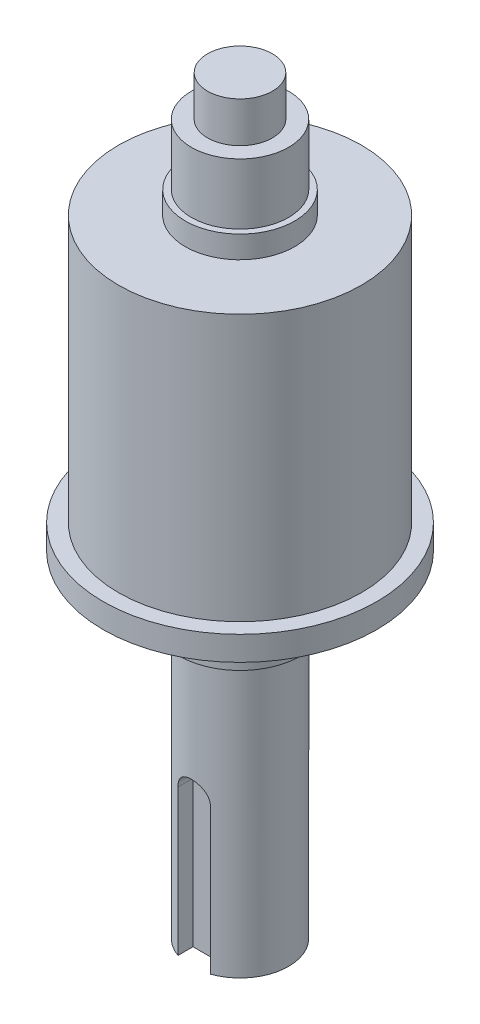
from build123d import *

# Parameters (mm, degrees)
CUT_EXTRUDE1_DEPTH = 15
CUT_EXTRUDE2_DEPTH = 97.309063486


with BuildPart() as part:
    # Sketch2 → Revolve1 (revolve)
    with BuildSketch(Plane.XY):
        Polygon((0, 0), (-4, 0), (-4, -5), (-6, -5), (-6, -12.5), (-6.75, -12.5), (-6.75, -15.25), (-14.9815, -15.25), (-14.9815, -48.11), (-16.8815, -48.11), (-16.8815, -51.11), (-8.25, -51.11), (-8.25, -53.61), (-7.5, -53.61), (-7.5, -58.61), (-6, -58.61), (-6, -92.535), (0, -92.535), align=None)
    revolve(axis=Axis((0, 40.033449689, 0), (0, -1, 0)))

    # Sketch3 → Cut-Extrude1 (cut)
    with BuildSketch(Plane.XZ.offset(92.535)):
        with BuildLine():
            Line((-2, 5.656854249), (-2, 3.8))
            Line((-2, 3.8), (2, 3.8))
            Line((2, 3.8), (2, 5.656854249))
            ThreePointArc((2, 5.656854249), (0, 6), (-2, 5.656854249))
        make_face()
    extrude(amount=-CUT_EXTRUDE1_DEPTH, mode=Mode.SUBTRACT)

    # Sketch4 → Cut-Extrude2 (cut, through all)
    with BuildSketch(Plane.XY.offset(3.8)):
        with BuildLine():
            Line((-2, -77.535), (-2, -74.535))
            ThreePointArc((-2, -74.535), (0, -72.535), (2, -74.535))
            Line((2, -74.535), (2, -77.535))
            Line((2, -77.535), (2, -92.535))
            Line((2, -92.535), (-2, -92.535))
            Line((-2, -92.535), (-2, -77.535))
        make_face()
    extrude(amount=CUT_EXTRUDE2_DEPTH, mode=Mode.SUBTRACT)


solid = part.part
